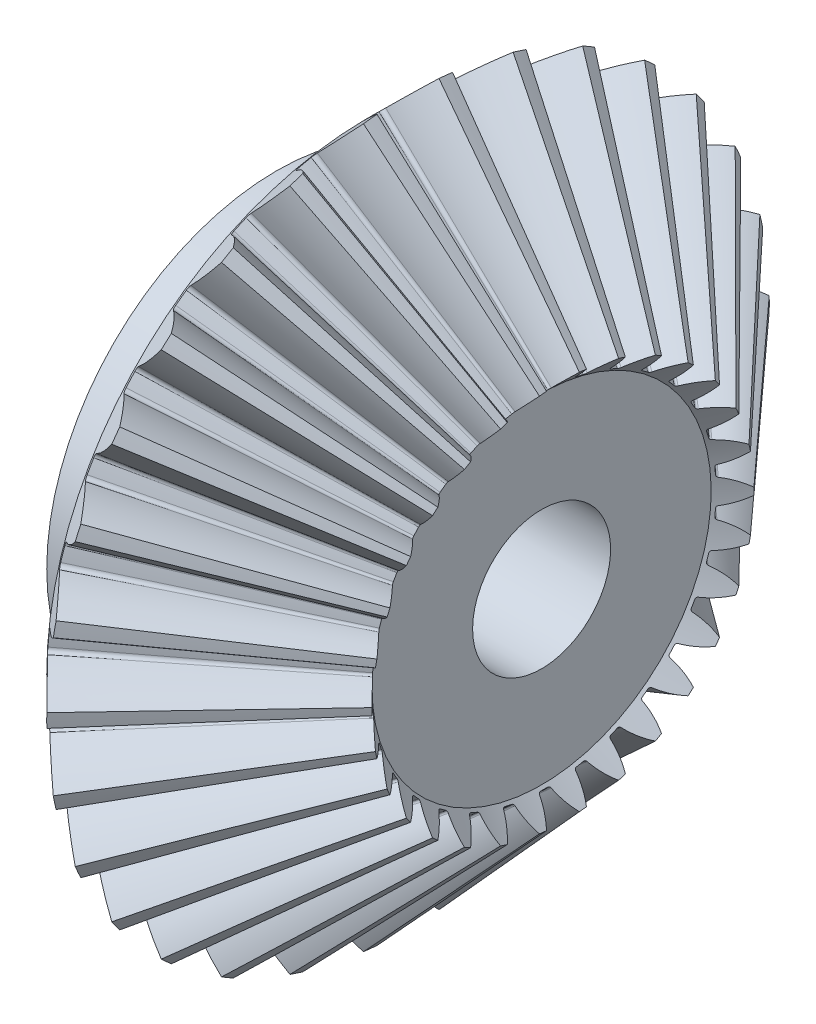
from build123d import *

# Parameters (mm, degrees)
TEETHCUTS_COUNT = 30
TEETHCUTS_ANGLE = 348
HUBSKE_R        = 10
HUB_DEPTH       = 3.949164146
BORSKE_R        = 3
BORE_DEPTH      = 20.0000508


with BuildPart() as part:
    # BasProSke → Base-Revolve (revolve)
    with BuildSketch(Plane(origin=(0, 0, 0), x_dir=(1, 0, 0), z_dir=(0, 1, 0)), mode=Mode.PRIVATE) as base_revolve_sk:
        Polygon((0, 0), (0, 13.949062547), (1.758044236, 15.707106781), (8.495778708, 8.302705629), (7.566484473, 7.373411396), (7.566484473, 0), align=None)
    revolve(base_revolve_sk.sketch.rotate(Axis((-10, 0, 0), (1, 0, 0)), 180), axis=Axis((-10, 0, 0), (1, 0, 0)))

    # ToothCut: read off the stored shape, not the designer's step
    # ToothCut: loft between two sections, ruled curve by curve
    toothcut_from = [
        Edge.make_bspline([(16.057310157, 0.006372702, -0.008948016), (16.052955033, 0.002017579, -0.015151394), (16.046805452, -0.004132002, -0.014267426), (16.04342198, -0.007515475, -0.006951667)], [0, 0, 0, 0, 1, 1, 1, 1], 3, [1, 0.752798, 0.752798, 1]),
        Edge.make_bspline([(16.04342198, -0.007515475, 0.006951667), (16.046805452, -0.004132002, 0.014267426), (16.052955033, 0.002017579, 0.015151394), (16.057310157, 0.006372702, 0.008948016)], [0, 0, 0, 0, 1, 1, 1, 1], 3, [1, 0.752798, 0.752798, 1]),
        Edge.make_bspline([(16.04342198, -0.007515475, -0.006951667), (16.042991938, -0.007945517, -0.00602183), (16.042651363, -0.008286091, -0.005020587), (16.042406078, -0.008531377, -0.003965059)], [0, 0, 0, 0, 1, 1, 1, 1], 3, [1, 0.994300589, 0.994300589, 1]),
        Edge.make_bspline([(16.042406078, -0.008531377, 0.003965059), (16.042651363, -0.008286091, 0.005020587), (16.042991938, -0.007945517, 0.00602183), (16.04342198, -0.007515475, 0.006951667)], [0, 0, 0, 0, 1, 1, 1, 1], 3, [1, 0.994300589, 0.994300589, 1]),
        Edge.make_bspline([(16.042406078, -0.008531377, -0.003965059), (16.041802396, -0.009135059, -0.001367249), (16.041802396, -0.009135059, 0.001367249), (16.042406078, -0.008531377, 0.003965059)], [0, 0, 0, 0, 1, 1, 1, 1], 3, [1, 0.966675555, 0.966675555, 1]),
        Edge.make_line((16.057310157, 0.006372702, 0.008948016), (16.057310157, 0.006372702, -0.008948016)),
    ]
    toothcut_to = [
        Edge.make_bspline([(1.93183305, 15.880895594, -1.554738237), (1.450416696, 15.39947924, -1.033713021), (0.902073449, 14.851135995, -0.668158569), (0.311519787, 14.260582334, -0.474552183)], [0, 0, 0, 0, 1, 1, 1, 1], 3, [1, 0.984975059, 0.984975059, 1]),
        Edge.make_bspline([(0.311519787, 14.260582334, 0.474552183), (0.902073449, 14.851135995, 0.668158569), (1.450416696, 15.39947924, 1.033713021), (1.93183305, 15.880895594, 1.554738237)], [0, 0, 0, 0, 1, 1, 1, 1], 3, [1, 0.984975059, 0.984975059, 1]),
        Edge.make_bspline([(0.311519787, 14.260582334, -0.474552183), (0.247234926, 14.196297473, -0.453477114), (0.206716831, 14.155779378, -0.379816993), (0.208085806, 14.157148353, -0.286513739)], [0, 0, 0, 0, 1, 1, 1, 1], 3, [1, 0.850928303, 0.850928303, 1]),
        Edge.make_bspline([(0.208085806, 14.157148353, 0.286513739), (0.206716831, 14.155779378, 0.379816993), (0.247234926, 14.196297473, 0.453477114), (0.311519787, 14.260582334, 0.474552183)], [0, 0, 0, 0, 1, 1, 1, 1], 3, [1, 0.850928303, 0.850928303, 1]),
        Edge.make_bspline([(0.208085806, 14.157148353, -0.286513739), (0.210888153, 14.1599507, -0.095518284), (0.210888153, 14.1599507, 0.095518284), (0.208085806, 14.157148353, 0.286513739)], [0, 0, 0, 0, 1, 1, 1, 1], 3, [1, 0.999856528, 0.999856528, 1]),
        Edge.make_line((1.93183305, 15.880895594, 1.554738237), (1.93183305, 15.880895594, -1.554738237)),
    ]
    toothcut = Solid(Shell([*[Face.make_surface_from_curves(toothcut_from[k], toothcut_to[k]) for k in range(6)], Face(Wire(toothcut_from)), Face(Wire(toothcut_to))]))
    add(toothcut, mode=Mode.SUBTRACT)

    # TeethCuts: ToothCut ×30 about axis
    teethcuts_axis = Axis((-10, 0, 0), (1, 0, 0))
    for i in range(1, TEETHCUTS_COUNT):
        add(toothcut.rotate(teethcuts_axis, i * TEETHCUTS_ANGLE / (TEETHCUTS_COUNT - 1)), mode=Mode.SUBTRACT)

    # HubSke → Hub (add)
    with BuildSketch(Plane.ZY):
        with Locations(Location((0, 0, 0), (0, 0, 180))):
            Circle(HUBSKE_R)
    extrude(amount=HUB_DEPTH)

    # BorSke → Bore (cut, symmetric)
    with BuildSketch(Plane(origin=(0, 0, 0), x_dir=(0, 0, -1), z_dir=(1, 0, 0))):
        with Locations(Location((0, 0, 0), (0, 0, 180))):
            Circle(BORSKE_R)
    extrude(amount=BORE_DEPTH, both=True, mode=Mode.SUBTRACT)


solid = part.part
